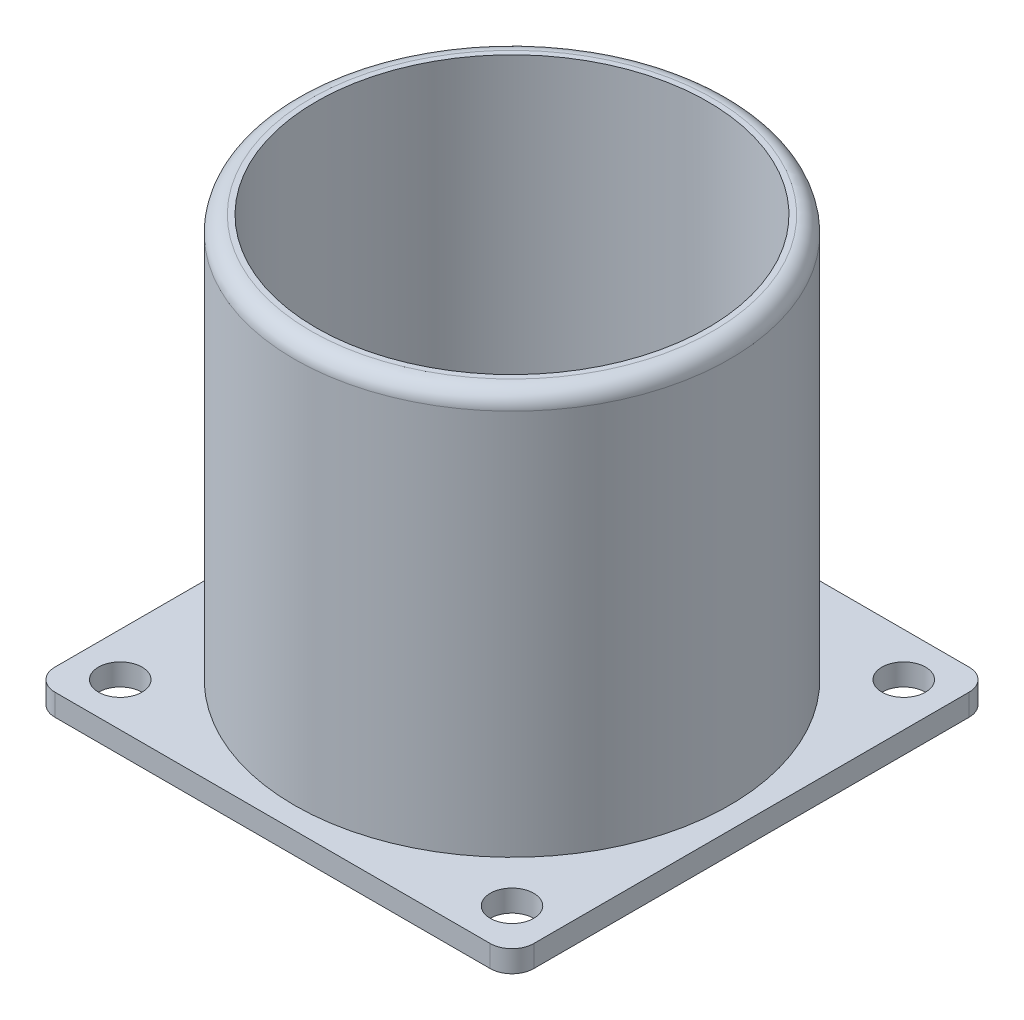
from build123d import *
from build123d.topology import SkipClean

# Parameters (mm, degrees)
ESBO_O1_W                = 44
ESBO_O1_H                = 44
RESSALTO_EXTRUS_O1_DEPTH = 2
ESBO_O3_R                = 20
ESBO_O3_R_2              = 18
RESSALTO_EXTRUS_O3_DEPTH = 37
FILETE3_R                = 1.5
FILETE4_R                = 2


with BuildPart() as part:
    # Esboço1 → Ressalto-extrusão1 (new body)
    with BuildSketch(Plane(origin=(0, 0, 0), x_dir=(1, 0, 0), z_dir=(0, 1, 0))):
        Rectangle(ESBO_O1_W, ESBO_O1_H)
        with BuildLine():
            ThreePointArc((-16, -18), (-19.658312395, -19.118033989), (-17.25, -16.145950378))
            ThreePointArc((-17.25, -16.145950378), (-16.341687605, -16.881966011), (-16, -18))
        make_face(mode=Mode.SUBTRACT)
        with BuildLine():
            ThreePointArc((-3.75, -17.605041891), (-4.50417298, -17.427347066), (-5.25, -17.217360425))
            Line((-5.25, -17.217360425), (-5.25, 17.217360425))
            ThreePointArc((-5.25, 17.217360425), (-4.50417298, 17.427347066), (-3.75, 17.605041891))
            Line((-3.75, 17.605041891), (-3.75, -17.605041891))
        make_face(mode=Mode.SUBTRACT)
        with BuildLine():
            ThreePointArc((20, -18), (16.881966011, -19.658312395), (17.25, -16.145950378))
            ThreePointArc((17.25, -16.145950378), (19.118033989, -16.341687605), (20, -18))
        make_face(mode=Mode.SUBTRACT)
        with BuildLine():
            ThreePointArc((-15.75, -8.714212529), (-16.596404379, -6.968454757), (-17.25, -5.14174095))
            Line((-17.25, -5.14174095), (-17.25, 5.14174095))
            ThreePointArc((-17.25, 5.14174095), (-16.596404379, 6.968454757), (-15.75, 8.714212529))
            Line((-15.75, 8.714212529), (-15.75, -8.714212529))
        make_face(mode=Mode.SUBTRACT)
        with BuildLine():
            ThreePointArc((-12.75, -12.70580576), (-13.527005163, -11.875189739), (-14.25, -10.997158724))
            Line((-14.25, -10.997158724), (-14.25, 10.997158724))
            ThreePointArc((-14.25, 10.997158724), (-13.527005163, 11.875189739), (-12.75, 12.70580576))
            Line((-12.75, 12.70580576), (-12.75, -12.70580576))
        make_face(mode=Mode.SUBTRACT)
        with BuildLine():
            ThreePointArc((-9.75, -15.130680751), (-10.513862046, -14.610226038), (-11.25, -14.051245496))
            Line((-11.25, -14.051245496), (-11.25, 14.051245496))
            ThreePointArc((-11.25, 14.051245496), (-10.513862046, 14.610226038), (-9.75, 15.130680751))
            Line((-9.75, 15.130680751), (-9.75, -15.130680751))
        make_face(mode=Mode.SUBTRACT)
        with BuildLine():
            ThreePointArc((-6.75, -16.686446596), (-7.507894085, -16.359447619), (-8.25, -15.998046756))
            Line((-8.25, -15.998046756), (-8.25, 15.998046756))
            ThreePointArc((-8.25, 15.998046756), (-7.507894085, 16.359447619), (-6.75, 16.686446596))
            Line((-6.75, 16.686446596), (-6.75, -16.686446596))
        make_face(mode=Mode.SUBTRACT)
        with BuildLine():
            Line((-0.75, 17.984368212), (-0.75, -17.984368212))
            ThreePointArc((-0.75, -17.984368212), (-1.501312927, -17.937281274), (-2.25, -17.85882135))
            Line((-2.25, -17.85882135), (-2.25, 17.85882135))
            ThreePointArc((-2.25, 17.85882135), (-1.501312927, 17.937281274), (-0.75, 17.984368212))
        make_face(mode=Mode.SUBTRACT)
        with BuildLine():
            ThreePointArc((-16, 18), (-16.341687605, 16.881966011), (-17.25, 16.145950378))
            ThreePointArc((-17.25, 16.145950378), (-19.658312395, 19.118033989), (-16, 18))
        make_face(mode=Mode.SUBTRACT)
        with BuildLine():
            ThreePointArc((2.25, -17.85882135), (1.501312927, -17.937281274), (0.75, -17.984368212))
            Line((0.75, -17.984368212), (0.75, 17.984368212))
            ThreePointArc((0.75, 17.984368212), (1.501312927, 17.937281274), (2.25, 17.85882135))
            Line((2.25, 17.85882135), (2.25, -17.85882135))
        make_face(mode=Mode.SUBTRACT)
        with BuildLine():
            ThreePointArc((5.25, -17.217360425), (4.50417298, -17.427347066), (3.75, -17.605041891))
            Line((3.75, -17.605041891), (3.75, 17.605041891))
            ThreePointArc((3.75, 17.605041891), (4.50417298, 17.427347066), (5.25, 17.217360425))
            Line((5.25, 17.217360425), (5.25, -17.217360425))
        make_face(mode=Mode.SUBTRACT)
        with BuildLine():
            ThreePointArc((8.25, -15.998046756), (7.507894085, -16.359447619), (6.75, -16.686446596))
            Line((6.75, -16.686446596), (6.75, 16.686446596))
            ThreePointArc((6.75, 16.686446596), (7.507894085, 16.359447619), (8.25, 15.998046756))
            Line((8.25, 15.998046756), (8.25, -15.998046756))
        make_face(mode=Mode.SUBTRACT)
        with BuildLine():
            ThreePointArc((11.25, -14.051245496), (10.513862046, -14.610226038), (9.75, -15.130680751))
            Line((9.75, -15.130680751), (9.75, 15.130680751))
            ThreePointArc((9.75, 15.130680751), (10.513862046, 14.610226038), (11.25, 14.051245496))
            Line((11.25, 14.051245496), (11.25, -14.051245496))
        make_face(mode=Mode.SUBTRACT)
        with BuildLine():
            ThreePointArc((14.25, -10.997158724), (13.527005163, -11.875189739), (12.75, -12.70580576))
            Line((12.75, -12.70580576), (12.75, 12.70580576))
            ThreePointArc((12.75, 12.70580576), (13.527005163, 11.875189739), (14.25, 10.997158724))
            Line((14.25, 10.997158724), (14.25, -10.997158724))
        make_face(mode=Mode.SUBTRACT)
        with BuildLine():
            ThreePointArc((17.25, -5.14174095), (16.596404379, -6.968454757), (15.75, -8.714212529))
            Line((15.75, -8.714212529), (15.75, 8.714212529))
            ThreePointArc((15.75, 8.714212529), (16.596404379, 6.968454757), (17.25, 5.14174095))
            Line((17.25, 5.14174095), (17.25, -5.14174095))
        make_face(mode=Mode.SUBTRACT)
        with BuildLine():
            ThreePointArc((20, 18), (19.118033989, 16.341687605), (17.25, 16.145950378))
            ThreePointArc((17.25, 16.145950378), (16.881966011, 19.658312395), (20, 18))
        make_face(mode=Mode.SUBTRACT)
    extrude(amount=RESSALTO_EXTRUS_O1_DEPTH)

    # Esboço3 → Ressalto-extrusão3 (add)
    with SkipClean():  # the faces are left unmerged after this step: merging them gives an invalid solid
        with BuildSketch(Plane(origin=(0, 2, 0), x_dir=(1, 0, 0), z_dir=(0, 1, 0))):
            Circle(ESBO_O3_R)
            Circle(ESBO_O3_R_2, mode=Mode.SUBTRACT)
        extrude(amount=RESSALTO_EXTRUS_O3_DEPTH)

    # Filete3
    filete3_edges = [part.edges().sort_by_distance(p)[0] for p in [
        (-20, 39, 0),
    ]]
    fillet(filete3_edges, radius=FILETE3_R)

    # Filete4
    filete4_edges = [part.edges().sort_by_distance(p)[0] for p in [
        (-22, 1, -22),
        (-22, 1, 22),
        (22, 1, 22),
        (22, 1, -22),
    ]]
    fillet(filete4_edges, radius=FILETE4_R)


solid = part.part
